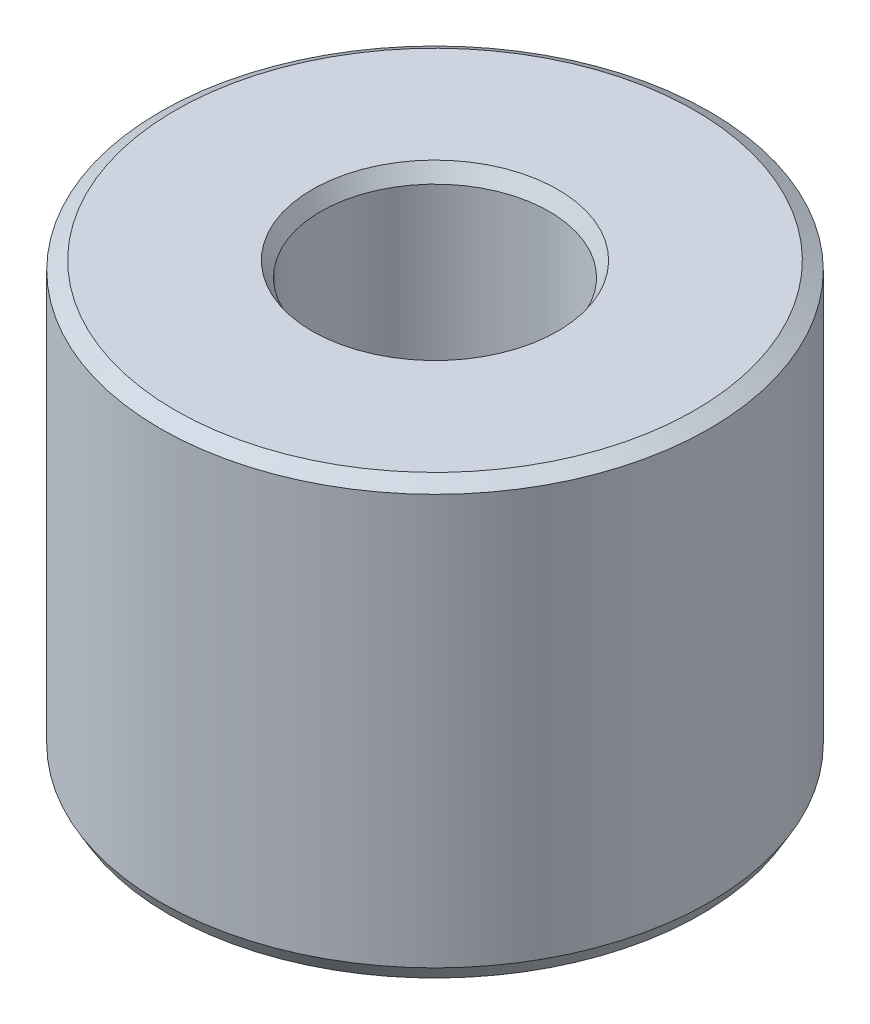
from build123d import *
from OCP.BRepFilletAPI import BRepFilletAPI_MakeChamfer

# Parameters (mm, degrees)
SKETCH1_R           = 40
BOSS_EXTRUDE1_DEPTH = 63.146387488
SKETCH2_R           = 16.644181824
CUT_EXTRUDE1_DEPTH  = 85.778925759
CHAMFER1_SIZE       = 1.244016363
CHAMFER1_SIZE2      = 2.154699546


with BuildPart() as part:
    # Sketch1 → Boss-Extrude1 (new body)
    with BuildSketch(Plane(origin=(0, 0, 0), x_dir=(1, 0, 0), z_dir=(0, 1, 0))):
        Circle(SKETCH1_R)
    extrude(amount=BOSS_EXTRUDE1_DEPTH)

    # Sketch2 → Cut-Extrude1 (cut, through all)
    with BuildSketch(Plane(origin=(0, 0, 0), x_dir=(1, 0, 0), z_dir=(0, 1, 0))):
        Circle(SKETCH2_R)
    extrude(amount=CUT_EXTRUDE1_DEPTH, mode=Mode.SUBTRACT)

    # Chamfer1: one chamfer whose edges measure the first distance from different faces: ONE call of the kernel's chamfer builder (chamfer() names one face for all edges)
    chamfer1_edges_1 = [part.edges().sort_by_distance(p)[0] for p in [
        (-16.644181824, 63.146387488, 0),
    ]]
    chamfer1_side_1 = [part.faces().sort_by_distance(p)[0] for p in [
        (-38.86862915, 63.146387488, 0),
    ]]
    chamfer1_edges_2 = [part.edges().sort_by_distance(p)[0] for p in [
        (-16.644181824, 0, 0),
    ]]
    chamfer1_side_2 = [part.faces().sort_by_distance(p)[0] for p in [
        (-16.644181824, 31.573193744, 0),
    ]]
    chamfer1_edges_3 = [part.edges().sort_by_distance(p)[0] for p in [
        (-40, 0, 0),
    ]]
    chamfer1_side_3 = [part.faces().sort_by_distance(p)[0] for p in [
        (-38.86862915, 0, 0),
    ]]
    chamfer1_edges_4 = [part.edges().sort_by_distance(p)[0] for p in [
        (-40, 63.146387488, 0),
    ]]
    chamfer1_side_4 = [part.faces().sort_by_distance(p)[0] for p in [
        (-40, 31.573193744, 0),
    ]]
    chamfer1 = BRepFilletAPI_MakeChamfer(part.part.solid().wrapped)
    for e in chamfer1_edges_1:
        chamfer1.Add(CHAMFER1_SIZE, CHAMFER1_SIZE2, e.wrapped, chamfer1_side_1[0].wrapped)  # the first distance lies on this face
    for e in chamfer1_edges_2:
        chamfer1.Add(CHAMFER1_SIZE, CHAMFER1_SIZE2, e.wrapped, chamfer1_side_2[0].wrapped)  # the first distance lies on this face
    for e in chamfer1_edges_3:
        chamfer1.Add(CHAMFER1_SIZE, CHAMFER1_SIZE2, e.wrapped, chamfer1_side_3[0].wrapped)  # the first distance lies on this face
    for e in chamfer1_edges_4:
        chamfer1.Add(CHAMFER1_SIZE, CHAMFER1_SIZE2, e.wrapped, chamfer1_side_4[0].wrapped)  # the first distance lies on this face
    add(Compound.cast(chamfer1.Shape()), mode=Mode.REPLACE)


solid = part.part
